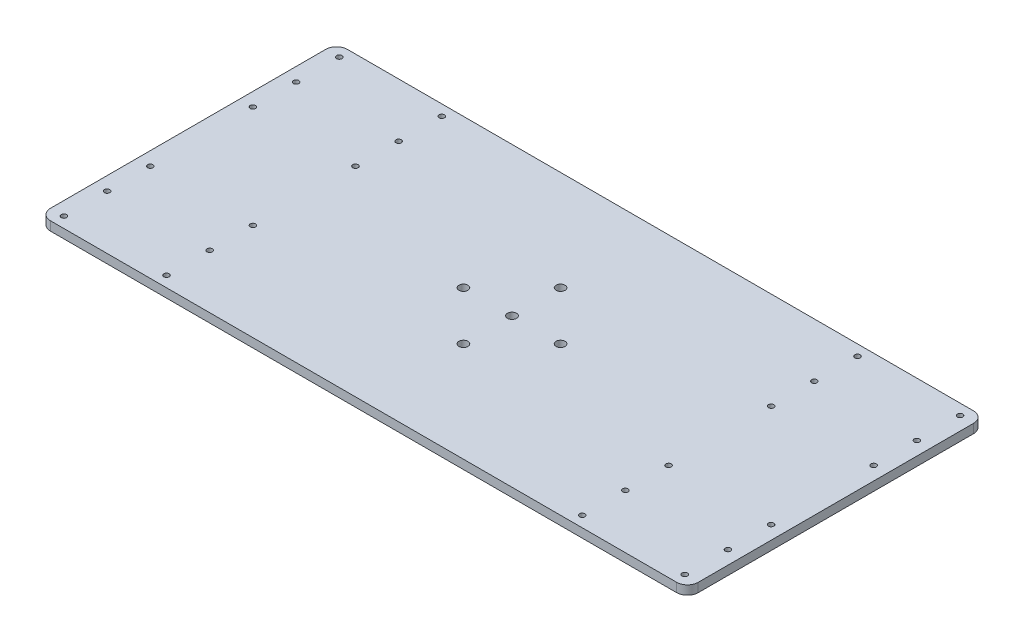
from build123d import *

# Parameters (mm, degrees)
SKETCH1_R           = 1.5
SKETCH1_R_2         = 2.5
BOSS_EXTRUDE1_DEPTH = 5


with BuildPart() as part:
    # Sketch1 → Boss-Extrude1 (new body)
    with BuildSketch(Plane(origin=(0, 0, 0), x_dir=(1, 0, 0), z_dir=(0, 1, 0))):
        with BuildLine():
            Line((-174, -82.5), (174, -82.5))
            ThreePointArc((174, -82.5), (178.242640687, -80.742640687), (180, -76.5))
            Line((180, -76.5), (180, 76.5))
            ThreePointArc((180, 76.5), (178.242640687, 80.742640687), (174, 82.5))
            Line((174, 82.5), (-174, 82.5))
            ThreePointArc((-174, 82.5), (-178.242640687, 80.742640687), (-180, 76.5))
            Line((-180, 76.5), (-180, -76.5))
            ThreePointArc((-180, -76.5), (-178.242640687, -80.742640687), (-174, -82.5))
        make_face()
        with Locations((-172.5, 76.5)):
            Circle(SKETCH1_R, mode=Mode.SUBTRACT)
        with Locations((-172.5, 52.5)):
            Circle(SKETCH1_R, mode=Mode.SUBTRACT)
        with Locations((-172.5, 28.5)):
            Circle(SKETCH1_R, mode=Mode.SUBTRACT)
        with Locations((-115.5, 76.5)):
            Circle(SKETCH1_R, mode=Mode.SUBTRACT)
        with Locations((-115.5, 52.5)):
            Circle(SKETCH1_R, mode=Mode.SUBTRACT)
        with Locations((-115.5, 28.5)):
            Circle(SKETCH1_R, mode=Mode.SUBTRACT)
        with Locations((115.5, 28.5)):
            Circle(SKETCH1_R, mode=Mode.SUBTRACT)
        with Locations((115.5, 52.5)):
            Circle(SKETCH1_R, mode=Mode.SUBTRACT)
        with Locations((115.5, 76.5)):
            Circle(SKETCH1_R, mode=Mode.SUBTRACT)
        with Locations((172.5, 28.5)):
            Circle(SKETCH1_R, mode=Mode.SUBTRACT)
        with Locations((172.5, 52.5)):
            Circle(SKETCH1_R, mode=Mode.SUBTRACT)
        with Locations((172.5, 76.5)):
            Circle(SKETCH1_R, mode=Mode.SUBTRACT)
        with Locations((172.5, -76.5)):
            Circle(SKETCH1_R, mode=Mode.SUBTRACT)
        with Locations((172.5, -52.5)):
            Circle(SKETCH1_R, mode=Mode.SUBTRACT)
        with Locations((172.5, -28.5)):
            Circle(SKETCH1_R, mode=Mode.SUBTRACT)
        with Locations((115.5, -76.5)):
            Circle(SKETCH1_R, mode=Mode.SUBTRACT)
        with Locations((115.5, -52.5)):
            Circle(SKETCH1_R, mode=Mode.SUBTRACT)
        with Locations((115.5, -28.5)):
            Circle(SKETCH1_R, mode=Mode.SUBTRACT)
        with Locations((-115.5, -28.5)):
            Circle(SKETCH1_R, mode=Mode.SUBTRACT)
        with Locations((-115.5, -52.5)):
            Circle(SKETCH1_R, mode=Mode.SUBTRACT)
        with Locations((-115.5, -76.5)):
            Circle(SKETCH1_R, mode=Mode.SUBTRACT)
        with Locations((-172.5, -28.5)):
            Circle(SKETCH1_R, mode=Mode.SUBTRACT)
        with Locations((-172.5, -52.5)):
            Circle(SKETCH1_R, mode=Mode.SUBTRACT)
        with Locations((-172.5, -76.5)):
            Circle(SKETCH1_R, mode=Mode.SUBTRACT)
        with Locations((0, 27)):
            Circle(SKETCH1_R_2, mode=Mode.SUBTRACT)
        with Locations((27, 0)):
            Circle(SKETCH1_R_2, mode=Mode.SUBTRACT)
        with Locations((0, -27)):
            Circle(SKETCH1_R_2, mode=Mode.SUBTRACT)
        with Locations((-27, 0)):
            Circle(SKETCH1_R_2, mode=Mode.SUBTRACT)
        Circle(SKETCH1_R_2, mode=Mode.SUBTRACT)
    extrude(amount=BOSS_EXTRUDE1_DEPTH)


solid = part.part
